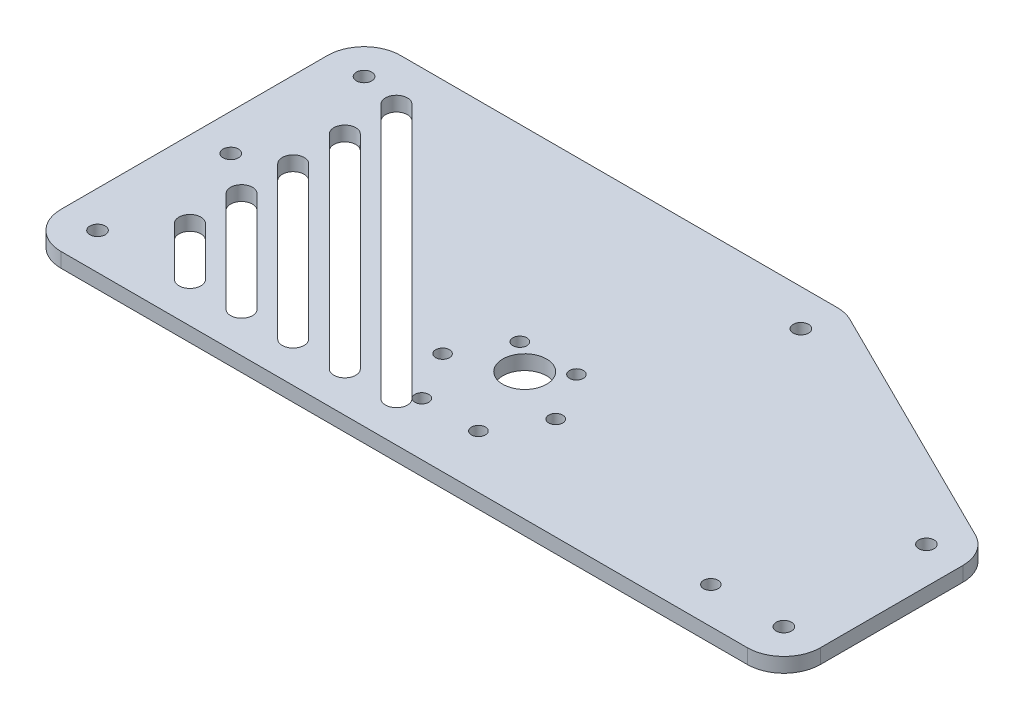
from build123d import *

# Parameters (mm, degrees)
BOSS_EXTRUDE1_DEPTH = 4
CUT_EXTRUDE1_REACH  = 212.632
SKETCH2_R           = 2.1
SKETCH2_R_2         = 6
SKETCH2_R_3         = 1.9
SKETCH2_R_4         = 2


with BuildPart() as part:
    # Sketch1 → Boss-Extrude1 (new body)
    with BuildSketch(Plane(origin=(0, 0, 0), x_dir=(-1, 0, 0), z_dir=(0, 1, 0))):
        with BuildLine():
            Line((192.449276181, -35), (72.796477455, -35))
            ThreePointArc((72.796477455, -35), (70.511379348, -34.7354161), (68.347201274, -33.955665328))
            Line((68.347201274, -33.955665328), (0, 0))
            ThreePointArc((0, 0), (-4.050510928, 3.687494953), (-5.550723819, 8.955665328))
            Line((-5.550723819, 8.955665328), (-5.550723819, 28))
            Line((-5.550723819, 28), (-5.550723819, 48))
            ThreePointArc((-5.550723819, 48), (-2.621791631, 55.071067812), (4.449276181, 58))
            Line((4.449276181, 58), (70.449276181, 58))
            Line((70.449276181, 58), (136.449276181, 58))
            Line((136.449276181, 58), (192.449276181, 58))
            ThreePointArc((192.449276181, 58), (199.520343993, 55.071067812), (202.449276181, 48))
            Line((202.449276181, 48), (202.449276181, 28))
            Line((202.449276181, 28), (202.449276181, 8))
            Line((202.449276181, 8), (202.449276181, -25))
            ThreePointArc((202.449276181, -25), (199.520343993, -32.071067812), (192.449276181, -35))
        make_face()
    extrude(amount=BOSS_EXTRUDE1_DEPTH)

    # Sketch2 → Cut-Extrude1 (cut, up to next)
    with BuildSketch(Plane.XZ, mode=Mode.PRIVATE) as cut_extrude1_sk1:
        with Locations((-192.449276181, 48)):
            Circle(SKETCH2_R)
    cut_extrude1_tool1 = extrude(cut_extrude1_sk1.sketch, amount=-CUT_EXTRUDE1_REACH, mode=Mode.PRIVATE) & part.part
    # Sketch2 → Cut-Extrude1 (cut, up to next)
    with BuildSketch(Plane.XZ, mode=Mode.PRIVATE) as cut_extrude1_sk2:
        with Locations((-192.449276181, -25)):
            Circle(SKETCH2_R)
    cut_extrude1_tool2 = extrude(cut_extrude1_sk2.sketch, amount=-CUT_EXTRUDE1_REACH, mode=Mode.PRIVATE) & part.part
    # Sketch2 → Cut-Extrude1 (cut, up to next)
    with BuildSketch(Plane.XZ, mode=Mode.PRIVATE) as cut_extrude1_sk3:
        with Locations((-192.449276181, 11.5)):
            Circle(SKETCH2_R)
    cut_extrude1_tool3 = extrude(cut_extrude1_sk3.sketch, amount=-CUT_EXTRUDE1_REACH, mode=Mode.PRIVATE) & part.part
    # Sketch2 → Cut-Extrude1 (cut, up to next)
    with BuildSketch(Plane.XZ, mode=Mode.PRIVATE) as cut_extrude1_sk4:
        with Locations((-4.449276181, 48)):
            Circle(SKETCH2_R)
    cut_extrude1_tool4 = extrude(cut_extrude1_sk4.sketch, amount=-CUT_EXTRUDE1_REACH, mode=Mode.PRIVATE) & part.part
    # Sketch2 → Cut-Extrude1 (cut, up to next)
    with BuildSketch(Plane.XZ, mode=Mode.PRIVATE) as cut_extrude1_sk5:
        with Locations((-4.449276181, 8.955665328)):
            Circle(SKETCH2_R)
    cut_extrude1_tool5 = extrude(cut_extrude1_sk5.sketch, amount=-CUT_EXTRUDE1_REACH, mode=Mode.PRIVATE) & part.part
    # Sketch2 → Cut-Extrude1 (cut, up to next)
    with BuildSketch(Plane.XZ, mode=Mode.PRIVATE) as cut_extrude1_sk6:
        with Locations((-72.796477455, -25)):
            Circle(SKETCH2_R)
    cut_extrude1_tool6 = extrude(cut_extrude1_sk6.sketch, amount=-CUT_EXTRUDE1_REACH, mode=Mode.PRIVATE) & part.part
    # Sketch2 → Cut-Extrude1 (cut, up to next)
    with BuildSketch(Plane.XZ, mode=Mode.PRIVATE) as cut_extrude1_sk7:
        with Locations((-100.442696949, 23)):
            Circle(SKETCH2_R_2)
    cut_extrude1_tool7 = extrude(cut_extrude1_sk7.sketch, amount=-CUT_EXTRUDE1_REACH, mode=Mode.PRIVATE) & part.part
    # Sketch2 → Cut-Extrude1 (cut, up to next)
    with BuildSketch(Plane.XZ, mode=Mode.PRIVATE) as cut_extrude1_sk8:
        with Locations((-115.942696949, 30)):
            Circle(SKETCH2_R_3)
    cut_extrude1_tool8 = extrude(cut_extrude1_sk8.sketch, amount=-CUT_EXTRUDE1_REACH, mode=Mode.PRIVATE) & part.part
    # Sketch2 → Cut-Extrude1 (cut, up to next)
    with BuildSketch(Plane.XZ, mode=Mode.PRIVATE) as cut_extrude1_sk9:
        with Locations((-108.192696949, 43.423393759)):
            Circle(SKETCH2_R_3)
    cut_extrude1_tool9 = extrude(cut_extrude1_sk9.sketch, amount=-CUT_EXTRUDE1_REACH, mode=Mode.PRIVATE) & part.part
    # Sketch2 → Cut-Extrude1 (cut, up to next)
    with BuildSketch(Plane.XZ, mode=Mode.PRIVATE) as cut_extrude1_sk10:
        with Locations((-92.692696949, 43.423393759)):
            Circle(SKETCH2_R_3)
    cut_extrude1_tool10 = extrude(cut_extrude1_sk10.sketch, amount=-CUT_EXTRUDE1_REACH, mode=Mode.PRIVATE) & part.part
    # Sketch2 → Cut-Extrude1 (cut, up to next)
    with BuildSketch(Plane.XZ, mode=Mode.PRIVATE) as cut_extrude1_sk11:
        with Locations((-84.942696949, 30)):
            Circle(SKETCH2_R_3)
    cut_extrude1_tool11 = extrude(cut_extrude1_sk11.sketch, amount=-CUT_EXTRUDE1_REACH, mode=Mode.PRIVATE) & part.part
    # Sketch2 → Cut-Extrude1 (cut, up to next)
    with BuildSketch(Plane.XZ, mode=Mode.PRIVATE) as cut_extrude1_sk12:
        with Locations((-92.692696949, 16.576606241)):
            Circle(SKETCH2_R_3)
    cut_extrude1_tool12 = extrude(cut_extrude1_sk12.sketch, amount=-CUT_EXTRUDE1_REACH, mode=Mode.PRIVATE) & part.part
    # Sketch2 → Cut-Extrude1 (cut, up to next)
    with BuildSketch(Plane.XZ, mode=Mode.PRIVATE) as cut_extrude1_sk13:
        with Locations((-108.192696949, 16.576606241)):
            Circle(SKETCH2_R_3)
    cut_extrude1_tool13 = extrude(cut_extrude1_sk13.sketch, amount=-CUT_EXTRUDE1_REACH, mode=Mode.PRIVATE) & part.part
    # Sketch2 → Cut-Extrude1 (cut, up to next)
    with BuildSketch(Plane.XZ, mode=Mode.PRIVATE) as cut_extrude1_sk14:
        with Locations((-24.449276181, 48)):
            Circle(SKETCH2_R_4)
    cut_extrude1_tool14 = extrude(cut_extrude1_sk14.sketch, amount=-CUT_EXTRUDE1_REACH, mode=Mode.PRIVATE) & part.part
    # Sketch2 → Cut-Extrude1 (cut, up to next)
    with BuildSketch(Plane.XZ, mode=Mode.PRIVATE) as cut_extrude1_sk15:
        with BuildLine():
            Line((-183.570596525, 21.669047558), (-156.118323739, 49.121320344))
            ThreePointArc((-156.118323739, 49.121320344), (-151.875683052, 49.121320344), (-151.875683052, 44.878679656))
            Line((-151.875683052, 44.878679656), (-179.327955837, 17.426406871))
            ThreePointArc((-179.327955837, 17.426406871), (-183.570596525, 17.426406871), (-183.570596525, 21.669047558))
        make_face()
    cut_extrude1_tool15 = extrude(cut_extrude1_sk15.sketch, amount=-CUT_EXTRUDE1_REACH, mode=Mode.PRIVATE) & part.part
    # Sketch2 → Cut-Extrude1 (cut, up to next)
    with BuildSketch(Plane.XZ, mode=Mode.PRIVATE) as cut_extrude1_sk16:
        with BuildLine():
            Line((-183.570596525, 7.526911935), (-141.976188116, 49.121320344))
            ThreePointArc((-141.976188116, 49.121320344), (-137.733547428, 49.121320344), (-137.733547428, 44.878679656))
            Line((-137.733547428, 44.878679656), (-179.327955837, 3.284271247))
            ThreePointArc((-179.327955837, 3.284271247), (-183.570596525, 3.284271247), (-183.570596525, 7.526911935))
        make_face()
    cut_extrude1_tool16 = extrude(cut_extrude1_sk16.sketch, amount=-CUT_EXTRUDE1_REACH, mode=Mode.PRIVATE) & part.part
    # Sketch2 → Cut-Extrude1 (cut, up to next)
    with BuildSketch(Plane.XZ, mode=Mode.PRIVATE) as cut_extrude1_sk17:
        with BuildLine():
            Line((-183.570596525, -6.615223689), (-127.834052492, 49.121320344))
            ThreePointArc((-127.834052492, 49.121320344), (-123.591411805, 49.121320344), (-123.591411805, 44.878679656))
            Line((-123.591411805, 44.878679656), (-179.327955837, -10.857864376))
            ThreePointArc((-179.327955837, -10.857864376), (-183.570596525, -10.857864376), (-183.570596525, -6.615223689))
        make_face()
    cut_extrude1_tool17 = extrude(cut_extrude1_sk17.sketch, amount=-CUT_EXTRUDE1_REACH, mode=Mode.PRIVATE) & part.part
    # Sketch2 → Cut-Extrude1 (cut, up to next)
    with BuildSketch(Plane.XZ, mode=Mode.PRIVATE) as cut_extrude1_sk18:
        with BuildLine():
            Line((-183.570596525, -20.757359313), (-113.691916868, 49.121320344))
            ThreePointArc((-113.691916868, 49.121320344), (-109.449276181, 49.121320344), (-109.449276181, 44.878679656))
            Line((-109.449276181, 44.878679656), (-179.327955837, -25))
            ThreePointArc((-179.327955837, -25), (-183.570596525, -25), (-183.570596525, -20.757359313))
        make_face()
    cut_extrude1_tool18 = extrude(cut_extrude1_sk18.sketch, amount=-CUT_EXTRUDE1_REACH, mode=Mode.PRIVATE) & part.part
    # Sketch2 → Cut-Extrude1 (cut, up to next)
    with BuildSketch(Plane.XZ, mode=Mode.PRIVATE) as cut_extrude1_sk19:
        with BuildLine():
            Line((-183.570596525, 35.811183182), (-170.260459363, 49.121320344))
            ThreePointArc((-170.260459363, 49.121320344), (-166.017818676, 49.121320344), (-166.017818676, 44.878679656))
            Line((-166.017818676, 44.878679656), (-179.327955837, 31.568542495))
            ThreePointArc((-179.327955837, 31.568542495), (-183.570596525, 31.568542495), (-183.570596525, 35.811183182))
        make_face()
    cut_extrude1_tool19 = extrude(cut_extrude1_sk19.sketch, amount=-CUT_EXTRUDE1_REACH, mode=Mode.PRIVATE) & part.part
    add(cut_extrude1_tool1.solids().sort_by_distance((-192.449276, 0, 48))[0], mode=Mode.SUBTRACT)
    add(cut_extrude1_tool2.solids().sort_by_distance((-192.449276, 0, -25))[0], mode=Mode.SUBTRACT)
    add(cut_extrude1_tool3.solids().sort_by_distance((-192.449276, 0, 11.5))[0], mode=Mode.SUBTRACT)
    add(cut_extrude1_tool4.solids().sort_by_distance((-4.449276, 0, 48))[0], mode=Mode.SUBTRACT)
    add(cut_extrude1_tool5.solids().sort_by_distance((-4.449276, 0, 8.955665))[0], mode=Mode.SUBTRACT)
    add(cut_extrude1_tool6.solids().sort_by_distance((-72.796477, 0, -25))[0], mode=Mode.SUBTRACT)
    add(cut_extrude1_tool7.solids().sort_by_distance((-100.442697, 0, 23))[0], mode=Mode.SUBTRACT)
    add(cut_extrude1_tool8.solids().sort_by_distance((-115.942697, 0, 30))[0], mode=Mode.SUBTRACT)
    add(cut_extrude1_tool9.solids().sort_by_distance((-108.192697, 0, 43.423394))[0], mode=Mode.SUBTRACT)
    add(cut_extrude1_tool10.solids().sort_by_distance((-92.692697, 0, 43.423394))[0], mode=Mode.SUBTRACT)
    add(cut_extrude1_tool11.solids().sort_by_distance((-84.942697, 0, 30))[0], mode=Mode.SUBTRACT)
    add(cut_extrude1_tool12.solids().sort_by_distance((-92.692697, 0, 16.576606))[0], mode=Mode.SUBTRACT)
    add(cut_extrude1_tool13.solids().sort_by_distance((-108.192697, 0, 16.576606))[0], mode=Mode.SUBTRACT)
    add(cut_extrude1_tool14.solids().sort_by_distance((-24.449276, 0, 48))[0], mode=Mode.SUBTRACT)
    add(cut_extrude1_tool15.solids().sort_by_distance((-167.72314, 0, 33.273864))[0], mode=Mode.SUBTRACT)
    add(cut_extrude1_tool16.solids().sort_by_distance((-160.652072, 0, 26.202796))[0], mode=Mode.SUBTRACT)
    add(cut_extrude1_tool17.solids().sort_by_distance((-153.581004, 0, 19.131728))[0], mode=Mode.SUBTRACT)
    add(cut_extrude1_tool18.solids().sort_by_distance((-146.509936, 0, 12.06066))[0], mode=Mode.SUBTRACT)
    add(cut_extrude1_tool19.solids().sort_by_distance((-174.794208, 0, 40.344931))[0], mode=Mode.SUBTRACT)


solid = part.part
